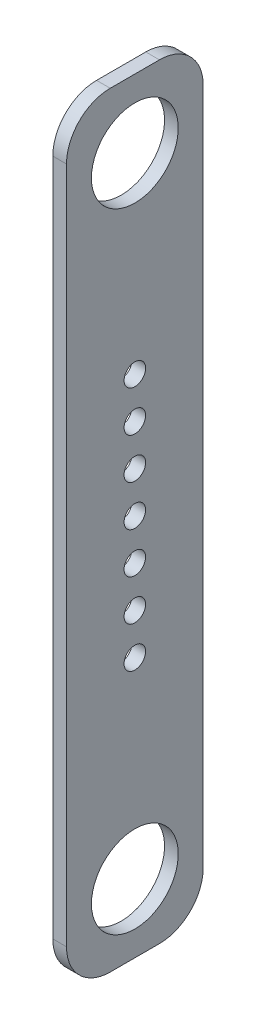
from build123d import *

# Parameters (mm, degrees)
SKETCH1_W               = 88.9
SKETCH1_H               = 15.875
BASE_FLANGE1_DEPTH      = 1.5875
F_2_5MM_DOWEL_HOLE1_D   = 2.5
LPATTERN1_COUNT         = 4
LPATTERN1_PITCH         = 4.750000025
LPATTERN1_COL_COUNT     = 4
LPATTERN1_COL_PITCH     = 4.750000025
FILLET1_R               = 5.08
F_3_8_CLEARANCE_HOLE1_D = 10.0838


# Sheet-metal steps are written as plain solids
with BuildPart() as part:
    # Sketch1 → Base-Flange1 (new body)
    with BuildSketch(Plane.YZ):
        Rectangle(SKETCH1_W, SKETCH1_H)
    extrude(amount=-BASE_FLANGE1_DEPTH)

    # Ø2.5mm Dowel Hole1 (through all)
    with Locations(Plane(origin=(-1.5875, 0, 0), x_dir=(0, -1, 0), z_dir=(-1, 0, 0))):
        with Locations((0, 0)):
            f_2_5mm_dowel_hole1 = Hole(F_2_5MM_DOWEL_HOLE1_D / 2)

    # LPattern1: Ø2.5mm Dowel Hole1 ×4
    with Locations(*[(0, -i * LPATTERN1_PITCH, 0) for i in range(1, LPATTERN1_COUNT)]):
        add(f_2_5mm_dowel_hole1, mode=Mode.SUBTRACT)

    # LPattern1 col: Ø2.5mm Dowel Hole1 ×4
    with Locations(*[(0, i * LPATTERN1_COL_PITCH, 0) for i in range(1, LPATTERN1_COL_COUNT)]):
        add(f_2_5mm_dowel_hole1, mode=Mode.SUBTRACT)

    # Fillet1
    fillet1_edges = [part.edges().sort_by_distance(p)[0] for p in [
        (-0.79375, -44.45, 7.9375),
        (-0.79375, 44.45, 7.9375),
        (-0.79375, 44.45, -7.9375),
        (-0.79375, -44.45, -7.9375),
    ]]
    fillet(fillet1_edges, radius=FILLET1_R)

    # 3/8 Clearance Hole1 (through all)
    with Locations(Plane(origin=(-1.5875, 0, 0), x_dir=(0, -1, 0), z_dir=(-1, 0, 0))):
        with Locations((-36.5125, 0), (36.5125, 0)):
            Hole(F_3_8_CLEARANCE_HOLE1_D / 2)


solid = part.part
